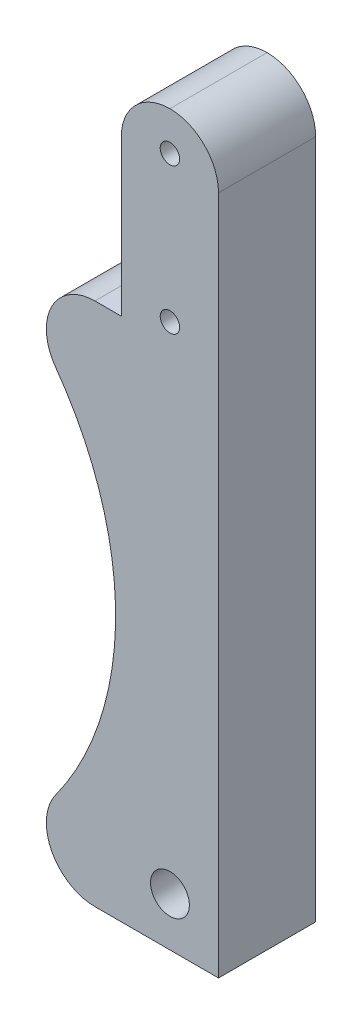
from build123d import *

# Parameters (mm, degrees)
ESQUISSE1_W             = 10
ESQUISSE1_H             = 75
BOSS_EXTRU_1_DEPTH      = 10
ESQUISSE2_R             = 1
ESQUISSE2_R_2           = 2
ENL_V_MAT_EXTRU_1_DEPTH = 10
CONG_1_R                = 5
BOSS_EXTRU_2_DEPTH      = 10
CONG_2_R                = 5


with BuildPart() as part:
    # Esquisse1 → Boss.-Extru.1 (new body)
    with BuildSketch(Plane.XY):
        with Locations((5, 37.5)):
            Rectangle(ESQUISSE1_W, ESQUISSE1_H)
    extrude(amount=BOSS_EXTRU_1_DEPTH)

    # Esquisse2 → Enlèv. mat.-Extru.1 (cut)
    with BuildSketch(Plane.XY.offset(10)):
        with Locations((5, 56)):
            Circle(ESQUISSE2_R)
        with Locations((5, 71)):
            Circle(ESQUISSE2_R)
        with Locations((5, 5)):
            Circle(ESQUISSE2_R_2)
    extrude(amount=-ENL_V_MAT_EXTRU_1_DEPTH, mode=Mode.SUBTRACT)

    # Congé1
    cong_1_edges = [part.edges().sort_by_distance(p)[0] for p in [
        (10, 75, 5),
        (0, 75, 5),
    ]]
    fillet(cong_1_edges, radius=CONG_1_R - 0.0001)  # a hair under: the kernel refuses the full size

    # Esquisse3 → Boss.-Extru.2 (add)
    with BuildSketch(Plane.XY.offset(10)):
        with BuildLine():
            Line((0, 0), (-15, 0))
            ThreePointArc((-15, 0), (-0.590052515, 27), (-15, 54))
            Line((-15, 54), (0, 54))
            Line((0, 54), (0, 0))
        make_face()
    extrude(amount=-BOSS_EXTRU_2_DEPTH)

    # Congé2
    cong_2_edges = [part.edges().sort_by_distance(p)[0] for p in [
        (-15, 0, 5),
        (-15, 54, 5),
    ]]
    fillet(cong_2_edges, radius=CONG_2_R)


solid = part.part
